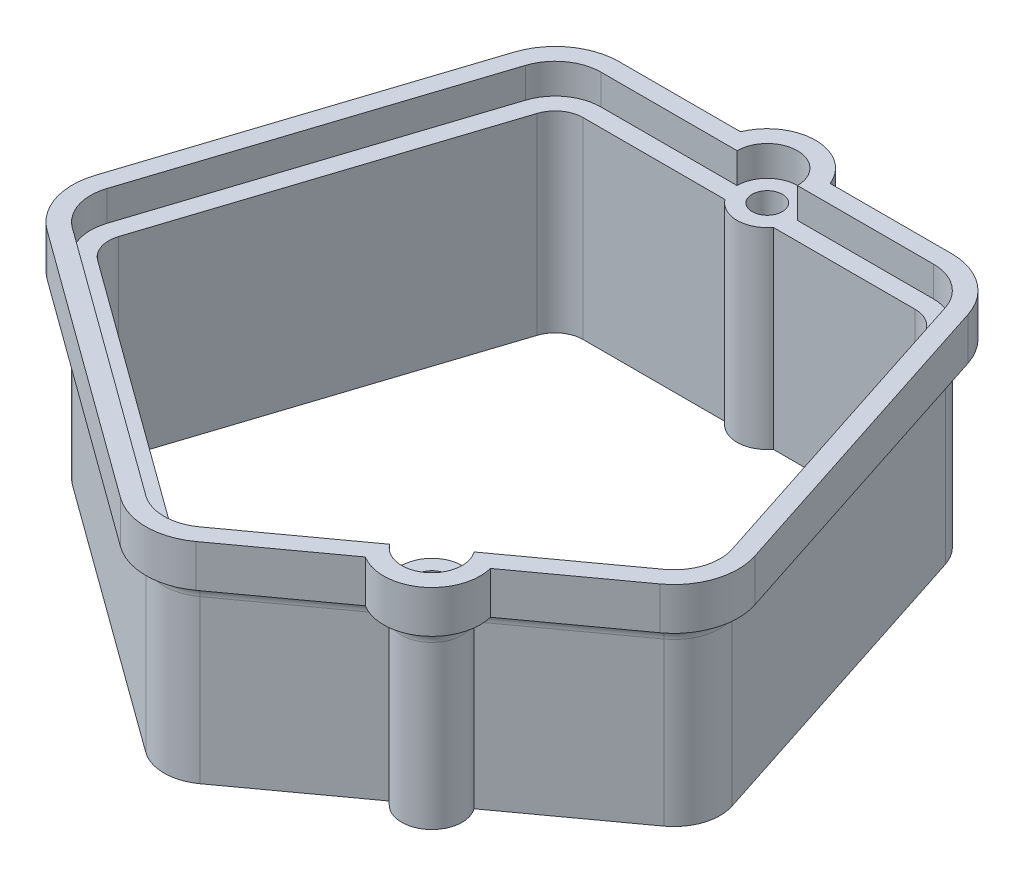
from build123d import *

# Parameters (mm, degrees)
SKETCH1_R                = 2.5
BOSS_EXTRUDE1_DEPTH      = 40
BOSS_EXTRUDE2_DEPTH      = 5
BOSS_EXTRUDE2_DEPTH_BACK = 2
FILLET1_R                = 3
BOSS_EXTRUDE3_START      = 7
SKETCH3_R                = 2.5
BOSS_EXTRUDE3_DEPTH      = 7
SKETCH4_R                = 2.5
CUT_EXTRUDE1_DEPTH       = 15.17


with BuildPart() as part:
    # Sketch1 → Boss-Extrude1 (new body)
    # profile 1 of 3: a face of its own
    with BuildSketch(Plane(origin=(0, 0, 0), x_dir=(1, 0, 0), z_dir=(0, 1, 0))):
        with BuildLine():
            Line((55.989380272, -10.721623107), (38.994348201, 41.58370731))
            ThreePointArc((38.994348201, 41.58370731), (36.22622117, 45.39370731), (31.747297547, 46.848997812))
            Line((31.747297547, 46.848997812), (9.248758018, 46.848997812))
            ThreePointArc((9.248758018, 46.848997812), (7.784291924, 50.384531718), (4.248758018, 51.848997812))
            Line((4.248758018, 51.848997812), (4.248758018, 50.848997812))
            ThreePointArc((4.248758018, 50.848997812), (1.420330893, 49.677424937), (0.248758018, 46.848997812))
            Line((0.248758018, 46.848997812), (-23.249781512, 46.848997812))
            ThreePointArc((-23.249781512, 46.848997812), (-27.728705135, 45.39370731), (-30.496832166, 41.58370731))
            Line((-30.496832166, 41.58370731), (-47.491864237, -10.721623107))
            ThreePointArc((-47.491864237, -10.721623107), (-47.491864237, -15.431042101), (-44.723737205, -19.241042101))
            Line((-44.723737205, -19.241042101), (-0.230165605, -51.567514092))
            ThreePointArc((-0.230165605, -51.567514092), (4.248758018, -53.022804594), (8.72768164, -51.567514092))
            Line((8.72768164, -51.567514092), (27.738399463, -37.755419106))
            ThreePointArc((27.738399463, -37.755419106), (30.34872958, -39.355031459), (33.325608449, -38.640346074))
            Line((33.325608449, -38.640346074), (33.913393702, -39.449363068))
            ThreePointArc((33.913393702, -39.449363068), (35.912909143, -36.186450422), (35.019552412, -32.465351835))
            Line((35.019552412, -32.465351835), (53.22125324, -19.241042101))
            ThreePointArc((53.22125324, -19.241042101), (55.989380272, -15.431042101), (55.989380272, -10.721623107))
        make_face()
        with Locations(Location((4.248758018, 46.848997812, 0), (0, 0, 270))):
            Circle(SKETCH1_R, mode=Mode.SUBTRACT)
        with Locations(Location((30.97446744, -35.404278096, 0), (0, 0, 270))):
            Circle(SKETCH1_R, mode=Mode.SUBTRACT)
        with BuildLine():
            ThreePointArc((-23.249781512, 43.848997812), (-25.965349378, 42.966656326), (-27.643662617, 40.656656326))
            Line((-27.643662617, 40.656656326), (-44.638694688, -11.64867409))
            ThreePointArc((-44.638694688, -11.64867409), (-44.638694688, -14.503991118), (-42.960381448, -16.813991118))
            Line((-42.960381448, -16.813991118), (1.533190152, -49.140463108))
            ThreePointArc((1.533190152, -49.140463108), (4.248758018, -50.022804594), (6.964325883, -49.140463108))
            Line((6.964325883, -49.140463108), (25.975043706, -35.328368122))
            ThreePointArc((25.975043706, -35.328368122), (28.035541179, -31.359193125), (32.447179661, -30.626086104))
            Line((32.447179661, -30.626086104), (51.457897483, -16.813991118))
            ThreePointArc((51.457897483, -16.813991118), (53.136210723, -14.503991118), (53.136210723, -11.64867409))
            Line((53.136210723, -11.64867409), (36.141178653, 40.656656326))
            ThreePointArc((36.141178653, 40.656656326), (34.462865413, 42.966656326), (31.747297547, 43.848997812))
            Line((31.747297547, 43.848997812), (8.248758018, 43.848997812))
            ThreePointArc((8.248758018, 43.848997812), (4.248758018, 41.848997812), (0.248758018, 43.848997812))
            Line((0.248758018, 43.848997812), (-23.249781512, 43.848997812))
        make_face(mode=Mode.SUBTRACT)
    # profile 2 of 3: a face of its own
    with BuildSketch(Plane(origin=(0, 0, 0), x_dir=(1, 0, 0), z_dir=(0, 1, 0))):
        with BuildLine():
            ThreePointArc((26.929382468, -38.343204358), (30.192295115, -40.342719799), (33.913393702, -39.449363068))
            Line((33.913393702, -39.449363068), (33.325608449, -38.640346074))
            ThreePointArc((33.325608449, -38.640346074), (30.34872958, -39.355031459), (27.738399463, -37.755419106))
            Line((27.738399463, -37.755419106), (26.929382468, -38.343204358))
        make_face()
    # profile 3 of 3: a face of its own
    with BuildSketch(Plane(origin=(0, 0, 0), x_dir=(1, 0, 0), z_dir=(0, 1, 0))):
        with BuildLine():
            Line((4.248758018, 50.848997812), (4.248758018, 51.848997812))
            ThreePointArc((4.248758018, 51.848997812), (0.713224112, 50.384531718), (-0.751241982, 46.848997812))
            Line((-0.751241982, 46.848997812), (0.248758018, 46.848997812))
            ThreePointArc((0.248758018, 46.848997812), (1.420330893, 49.677424937), (4.248758018, 50.848997812))
        make_face()
    extrude(amount=BOSS_EXTRUDE1_DEPTH)

    # Sketch2 → Boss-Extrude2 (add, two sides: drawn at the far end of the back side and taken through both)
    with BuildSketch(Plane(origin=(0, 40, 0), x_dir=(1, 0, 0), z_dir=(0, 1, 0)).offset(-BOSS_EXTRUDE2_DEPTH_BACK)):
        Polygon((-30.496832166, 41.58370731), (-33.350001715, 42.510758293), (-50.345033785, -9.794572124), (-47.491864237, -10.721623107), align=None)
        with BuildLine():
            Line((-1.993521362, -53.994565075), (-46.487092962, -21.668093084))
            ThreePointArc((-46.487092962, -21.668093084), (-50.345033785, -16.358093084), (-50.345033785, -9.794572124))
            Line((-50.345033785, -9.794572124), (-47.491864237, -10.721623107))
            ThreePointArc((-47.491864237, -10.721623107), (-47.491864237, -15.431042101), (-44.723737205, -19.241042101))
            Line((-44.723737205, -19.241042101), (-0.230165605, -51.567514092))
            ThreePointArc((-0.230165605, -51.567514092), (4.248758018, -53.022804594), (8.72768164, -51.567514092))
            Line((8.72768164, -51.567514092), (26.929382468, -38.343204358))
            ThreePointArc((26.929382468, -38.343204358), (33.913393702, -39.449363068), (35.019552412, -32.465351835))
            Line((35.019552412, -32.465351835), (53.22125324, -19.241042101))
            ThreePointArc((53.22125324, -19.241042101), (55.989380272, -15.431042101), (55.989380272, -10.721623107))
            Line((55.989380272, -10.721623107), (38.994348201, 41.58370731))
            ThreePointArc((38.994348201, 41.58370731), (36.22622117, 45.39370731), (31.747297547, 46.848997812))
            Line((31.747297547, 46.848997812), (9.248758018, 46.848997812))
            ThreePointArc((9.248758018, 46.848997812), (4.248758018, 51.848997812), (-0.751241982, 46.848997812))
            Line((-0.751241982, 46.848997812), (-23.249781512, 46.848997812))
            Line((-23.249781512, 46.848997812), (-23.249781512, 49.848997812))
            Line((-23.249781512, 49.848997812), (-3.16744047, 49.848997812))
            ThreePointArc((-3.16744047, 49.848997812), (4.248758018, 54.848997812), (11.664956505, 49.848997812))
            Line((11.664956505, 49.848997812), (31.747297547, 49.848997812))
            ThreePointArc((31.747297547, 49.848997812), (37.989576927, 47.820758293), (41.84751775, 42.510758293))
            Line((41.84751775, 42.510758293), (58.842549821, -9.794572124))
            ThreePointArc((58.842549821, -9.794572124), (58.842549821, -16.358093084), (54.984608997, -21.668093084))
            Line((54.984608997, -21.668093084), (38.737653807, -33.472196981))
            ThreePointArc((38.737653807, -33.472196981), (35.676749458, -41.876414051), (26.737992587, -42.190461178))
            Line((26.737992587, -42.190461178), (10.491037397, -53.994565075))
            ThreePointArc((10.491037397, -53.994565075), (4.248758018, -56.022804594), (-1.993521362, -53.994565075))
        make_face()
        with BuildLine():
            ThreePointArc((-33.350001715, 42.510758293), (-29.492060891, 47.820758293), (-23.249781512, 49.848997812))
            Line((-23.249781512, 49.848997812), (-23.249781512, 46.848997812))
            ThreePointArc((-23.249781512, 46.848997812), (-27.728705135, 45.39370731), (-30.496832166, 41.58370731))
            Line((-30.496832166, 41.58370731), (-33.350001715, 42.510758293))
        make_face()
    extrude(amount=BOSS_EXTRUDE2_DEPTH + BOSS_EXTRUDE2_DEPTH_BACK)

    # Fillet1
    fillet1_edges = [part.edges().sort_by_distance(p)[0] for p in [
        (-38.994348201, 38, -15.431042101),
        (-47.491864237, 38, 15.431042101),
        (-22.476951405, 38, 35.404278096),
        (4.248758018, 38, 53.022804594),
        (17.828532054, 38, 44.955359225),
        (33.913393702, 38, 39.449363068),
        (44.120402826, 38, 25.853196968),
        (55.989380272, 38, 15.431042101),
        (47.491864237, 38, -15.431042101),
        (36.22622117, 38, -45.39370731),
        (20.498027782, 38, -46.848997812),
        (4.248758018, 38, -51.848997812),
        (-12.000511747, 38, -46.848997812),
        (-27.728705135, 38, -45.39370731),
    ]]
    fillet(fillet1_edges, radius=FILLET1_R - 0.0001)  # a hair under: the kernel refuses the full size

    # Sketch3 → Boss-Extrude3 (add)
    with BuildSketch(Plane.XZ.offset(BOSS_EXTRUDE3_START)):
        with BuildLine():
            Line((38.994348201, -41.58370731), (55.989380272, 10.721623107))
            ThreePointArc((55.989380272, 10.721623107), (55.989380272, 15.431042101), (53.22125324, 19.241042101))
            Line((53.22125324, 19.241042101), (35.019552412, 32.465351835))
            ThreePointArc((35.019552412, 32.465351835), (33.913393702, 39.449363068), (26.929382468, 38.343204358))
            Line((26.929382468, 38.343204358), (8.72768164, 51.567514092))
            ThreePointArc((8.72768164, 51.567514092), (4.248758018, 53.022804594), (-0.230165605, 51.567514092))
            Line((-0.230165605, 51.567514092), (-44.723737205, 19.241042101))
            ThreePointArc((-44.723737205, 19.241042101), (-47.491864237, 15.431042101), (-47.491864237, 10.721623107))
            Line((-47.491864237, 10.721623107), (-30.496832166, -41.58370731))
            ThreePointArc((-30.496832166, -41.58370731), (-27.728705135, -45.39370731), (-23.249781512, -46.848997812))
            Line((-23.249781512, -46.848997812), (-0.751241982, -46.848997812))
            ThreePointArc((-0.751241982, -46.848997812), (4.248758018, -51.848997812), (9.248758018, -46.848997812))
            Line((9.248758018, -46.848997812), (31.747297547, -46.848997812))
            ThreePointArc((31.747297547, -46.848997812), (36.22622117, -45.39370731), (38.994348201, -41.58370731))
        make_face()
        with Locations(Location((30.97446744, 35.404278096, 0), (0, 0, 270))):
            Circle(SKETCH3_R, mode=Mode.SUBTRACT)
        with Locations(Location((4.248758018, -46.848997812, 0), (0, 0, 270))):
            Circle(SKETCH3_R, mode=Mode.SUBTRACT)
        with BuildLine():
            Line((-44.638694688, 11.64867409), (-27.643662617, -40.656656326))
            ThreePointArc((-27.643662617, -40.656656326), (-25.965349378, -42.966656326), (-23.249781512, -43.848997812))
            Line((-23.249781512, -43.848997812), (0.248758018, -43.848997812))
            ThreePointArc((0.248758018, -43.848997812), (4.248758018, -41.848997812), (8.248758018, -43.848997812))
            Line((8.248758018, -43.848997812), (31.747297547, -43.848997812))
            ThreePointArc((31.747297547, -43.848997812), (34.462865413, -42.966656326), (36.141178653, -40.656656326))
            Line((36.141178653, -40.656656326), (53.136210723, 11.64867409))
            ThreePointArc((53.136210723, 11.64867409), (53.136210723, 14.503991118), (51.457897483, 16.813991118))
            Line((51.457897483, 16.813991118), (32.447179661, 30.626086104))
            ThreePointArc((32.447179661, 30.626086104), (28.035541179, 31.359193125), (25.975043706, 35.328368122))
            Line((25.975043706, 35.328368122), (6.964325883, 49.140463108))
            ThreePointArc((6.964325883, 49.140463108), (4.248758018, 50.022804594), (1.533190152, 49.140463108))
            Line((1.533190152, 49.140463108), (-42.960381448, 16.813991118))
            ThreePointArc((-42.960381448, 16.813991118), (-44.638694688, 14.503991118), (-44.638694688, 11.64867409))
        make_face(mode=Mode.SUBTRACT)
    extrude(amount=-BOSS_EXTRUDE3_DEPTH)

    # Sketch4 → Cut-Extrude1 (cut)
    with BuildSketch(Plane.XZ.offset(7)):
        with BuildLine():
            Line((38.994348201, -41.58370731), (55.989380272, 10.721623107))
            ThreePointArc((55.989380272, 10.721623107), (55.989380272, 15.431042101), (53.22125324, 19.241042101))
            Line((53.22125324, 19.241042101), (35.019552412, 32.465351835))
            ThreePointArc((35.019552412, 32.465351835), (33.913393702, 39.449363068), (26.929382468, 38.343204358))
            Line((26.929382468, 38.343204358), (8.72768164, 51.567514092))
            ThreePointArc((8.72768164, 51.567514092), (4.248758018, 53.022804594), (-0.230165605, 51.567514092))
            Line((-0.230165605, 51.567514092), (-44.723737205, 19.241042101))
            ThreePointArc((-44.723737205, 19.241042101), (-47.491864237, 15.431042101), (-47.491864237, 10.721623107))
            Line((-47.491864237, 10.721623107), (-30.496832166, -41.58370731))
            ThreePointArc((-30.496832166, -41.58370731), (-27.728705135, -45.39370731), (-23.249781512, -46.848997812))
            Line((-23.249781512, -46.848997812), (-0.751241982, -46.848997812))
            ThreePointArc((-0.751241982, -46.848997812), (4.248758018, -51.848997812), (9.248758018, -46.848997812))
            Line((9.248758018, -46.848997812), (31.747297547, -46.848997812))
            ThreePointArc((31.747297547, -46.848997812), (36.22622117, -45.39370731), (38.994348201, -41.58370731))
        make_face()
        with Locations(Location((30.97446744, 35.404278096, 0), (0, 0, 270))):
            Circle(SKETCH4_R, mode=Mode.SUBTRACT)
        with Locations(Location((4.248758018, -46.848997812, 0), (0, 0, 270))):
            Circle(SKETCH4_R, mode=Mode.SUBTRACT)
        with BuildLine():
            Line((-23.249781512, -43.848997812), (0.248758018, -43.848997812))
            ThreePointArc((0.248758018, -43.848997812), (4.248758018, -41.848997812), (8.248758018, -43.848997812))
            Line((8.248758018, -43.848997812), (31.747297547, -43.848997812))
            ThreePointArc((31.747297547, -43.848997812), (34.462865413, -42.966656326), (36.141178653, -40.656656326))
            Line((36.141178653, -40.656656326), (53.136210723, 11.64867409))
            ThreePointArc((53.136210723, 11.64867409), (53.136210723, 14.503991118), (51.457897483, 16.813991118))
            Line((51.457897483, 16.813991118), (32.447179661, 30.626086104))
            ThreePointArc((32.447179661, 30.626086104), (28.035541179, 31.359193125), (25.975043706, 35.328368122))
            Line((25.975043706, 35.328368122), (6.964325883, 49.140463108))
            ThreePointArc((6.964325883, 49.140463108), (4.248758018, 50.022804594), (1.533190152, 49.140463108))
            Line((1.533190152, 49.140463108), (-42.960381448, 16.813991118))
            ThreePointArc((-42.960381448, 16.813991118), (-44.638694688, 14.503991118), (-44.638694688, 11.64867409))
            Line((-44.638694688, 11.64867409), (-27.643662617, -40.656656326))
            ThreePointArc((-27.643662617, -40.656656326), (-25.965349378, -42.966656326), (-23.249781512, -43.848997812))
        make_face(mode=Mode.SUBTRACT)
    extrude(amount=-CUT_EXTRUDE1_DEPTH, mode=Mode.SUBTRACT)


solid = part.part
